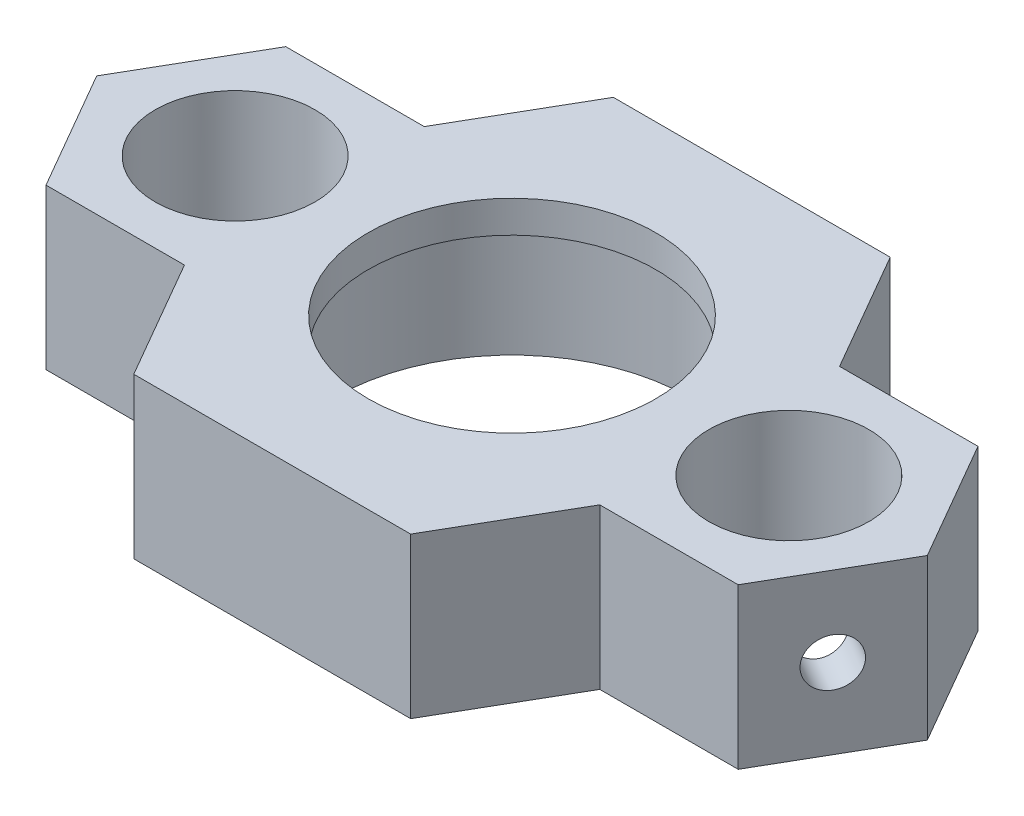
from build123d import *

# Parameters (mm, degrees)
SKETCH1_R                      = 11.125
SKETCH1_R_2                    = 5
BOSS_EXTRUDE1_DEPTH            = 8
SKETCH2_R                      = 9
SKETCH2_R_2                    = 5
BOSS_EXTRUDE2_DEPTH            = 2
CUT_EXTRUDE1_REACH             = 55.444
CUT_EXTRUDE1_END_RADIUS        = 5
SKETCH4_R                      = 1.5
CUT_EXTRUDE1_DIRECTION_2_DEPTH = 54.443895816
CUT_EXTRUDE2_REACH             = 55.444
CUT_EXTRUDE2_END_RADIUS        = 5
SKETCH5_R                      = 1.5


with BuildPart() as part:
    # Sketch1 → Boss-Extrude1 (new body)
    with BuildSketch(Plane(origin=(0, 0, 0), x_dir=(1, 0, 0), z_dir=(0, 1, 0))):
        Polygon((8.660254038, 15), (-8.660254038, 15), (-12.990381057, 7.5), (-21.650635095, 7.5), (-25.980762114, 0), (-21.650635095, -7.5), (-12.990381057, -7.5), (-8.660254038, -15), (8.660254038, -15), (12.990381057, -7.5), (21.650635095, -7.5), (25.980762114, 0), (21.650635095, 7.5), (12.990381057, 7.5), align=None)
        Circle(SKETCH1_R, mode=Mode.SUBTRACT)
        with Locations((17.320508076, 0)):
            Circle(SKETCH1_R_2, mode=Mode.SUBTRACT)
        with Locations((-17.320508076, 0)):
            Circle(SKETCH1_R_2, mode=Mode.SUBTRACT)
    extrude(amount=BOSS_EXTRUDE1_DEPTH)

    # Sketch2 → Boss-Extrude2 (add)
    with BuildSketch(Plane(origin=(0, 8, 0), x_dir=(1, 0, 0), z_dir=(0, 1, 0))):
        Polygon((-8.660254038, 15), (-12.990381057, 7.5), (-21.650635095, 7.5), (-25.980762114, 0), (-21.650635095, -7.5), (-12.990381057, -7.5), (-8.660254038, -15), (8.660254038, -15), (12.990381057, -7.5), (21.650635095, -7.5), (25.980762114, 0), (21.650635095, 7.5), (12.990381057, 7.5), (8.660254038, 15), align=None)
        Circle(SKETCH2_R, mode=Mode.SUBTRACT)
        with Locations((-17.320508076, 0)):
            Circle(SKETCH2_R_2, mode=Mode.SUBTRACT)
        with Locations((17.320508076, 0)):
            Circle(SKETCH2_R_2, mode=Mode.SUBTRACT)
    extrude(amount=BOSS_EXTRUDE2_DEPTH)

    # Cut-Extrude1: up to this cylinder (the profile starts outside it)
    cut_extrude1_end = Plane(origin=(-17.320508076, 5, 0), z_dir=(0, -1, 0)) * Cylinder(CUT_EXTRUDE1_END_RADIUS, 121.888, mode=Mode.PRIVATE)
    # Sketch4 → Cut-Extrude1 (cut, up to the surface)
    with BuildSketch(Plane(origin=(-19.485571585, 0, 11.25), x_dir=(0.500000000000001, 0, 0.866025403784438), z_dir=(-0.866025403784438, 0, 0.500000000000001)), mode=Mode.PRIVATE) as cut_extrude1_sk1:
        with Locations((-8.660254038, 5)):
            Circle(SKETCH4_R)
    cut_extrude1_tool1 = extrude(cut_extrude1_sk1.sketch, amount=-CUT_EXTRUDE1_REACH, mode=Mode.PRIVATE) - cut_extrude1_end
    add(cut_extrude1_tool1.solids().sort_by_distance((-23.815699, 5, 3.75))[0], mode=Mode.SUBTRACT)

    # Sketch4 → Cut-Extrude1 direction 2 (cut)
    with BuildSketch(Plane(origin=(-19.485571585, 0, 11.25), x_dir=(0.500000000000001, 0, 0.866025403784438), z_dir=(-0.866025403784438, 0, 0.500000000000001))):
        with Locations((-8.660254038, 5)):
            Circle(SKETCH4_R)
    extrude(amount=CUT_EXTRUDE1_DIRECTION_2_DEPTH, mode=Mode.SUBTRACT)

    # Cut-Extrude2: up to this cylinder (the profile starts outside it)
    cut_extrude2_end = Plane(origin=(17.320508076, 5, 0), z_dir=(0, -1, 0)) * Cylinder(CUT_EXTRUDE2_END_RADIUS, 121.888, mode=Mode.PRIVATE)
    # Sketch5 → Cut-Extrude2 (cut, up to the surface)
    with BuildSketch(Plane(origin=(19.485571585, 0, 11.25), x_dir=(0.5000000000000004, 0, -0.8660254037844384), z_dir=(0.8660254037844384, 0, 0.5000000000000004)), mode=Mode.PRIVATE) as cut_extrude2_sk1:
        with Locations((8.660254038, 5)):
            Circle(SKETCH5_R)
    cut_extrude2_tool1 = extrude(cut_extrude2_sk1.sketch, amount=-CUT_EXTRUDE2_REACH, mode=Mode.PRIVATE) - cut_extrude2_end
    add(cut_extrude2_tool1.solids().sort_by_distance((23.815699, 5, 3.75))[0], mode=Mode.SUBTRACT)


solid = part.part
